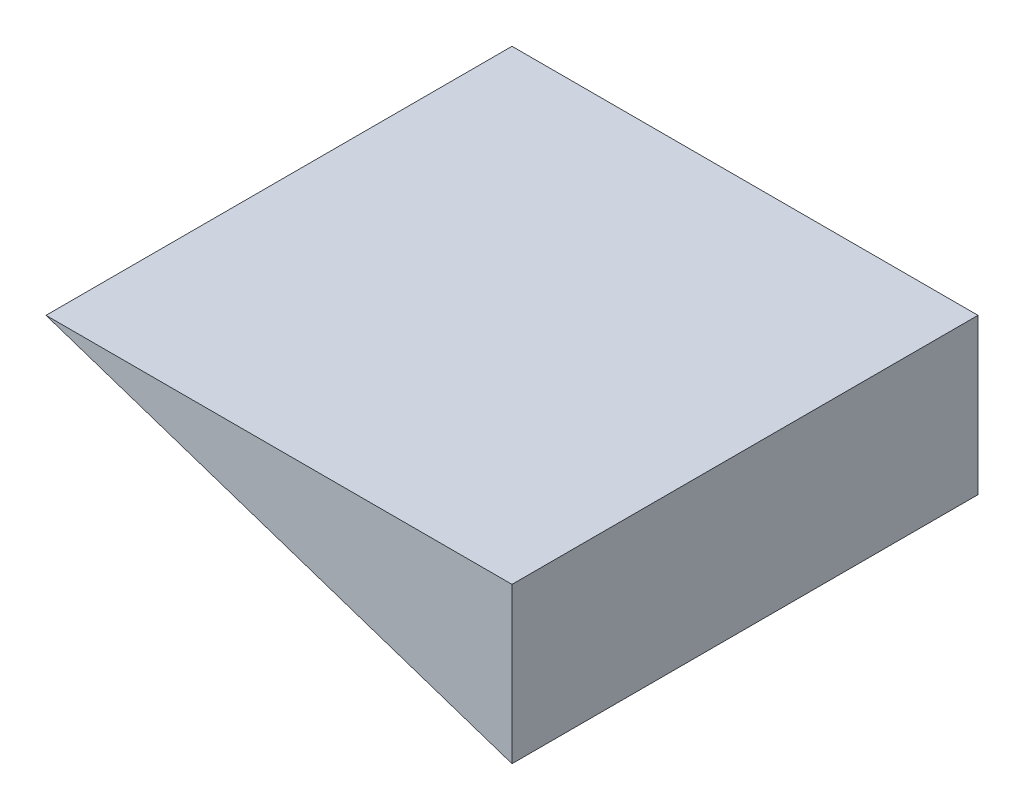
from build123d import *

# Parameters (mm, degrees)
SKETCH1_W           = 300
SKETCH1_H           = 100
BOSS_EXTRUDE1_DEPTH = 300
SKETCH3_W           = 288
SKETCH3_H           = 94
CUT_EXTRUDE2_DEPTH  = 294
CUT_EXTRUDE3_DEPTH  = 316
SCALE1_SCALE        = 0.001


with BuildPart() as part:
    # Sketch1 → Boss-Extrude1 (new body)
    with BuildSketch(Plane.XY):
        Rectangle(SKETCH1_W, SKETCH1_H)
    extrude(amount=-BOSS_EXTRUDE1_DEPTH)

    # Sketch3 → Cut-Extrude2 (cut)
    with BuildSketch(Plane.ZY.offset(150)):
        with Locations((-150, -3)):
            Rectangle(SKETCH3_W, SKETCH3_H)
    extrude(amount=-CUT_EXTRUDE2_DEPTH, mode=Mode.SUBTRACT)

    # Sketch2 → Cut-Extrude3 (cut)
    with BuildSketch(Plane.XY):
        Polygon((-150, 50), (-150, -50), (150, -50), align=None)
    extrude(amount=-CUT_EXTRUDE3_DEPTH, mode=Mode.SUBTRACT)


with BuildPart() as part_1:
    # Scale1: scaled about (0, 0, 0)
    add(part.part.scale(SCALE1_SCALE))


solid = part_1.part
